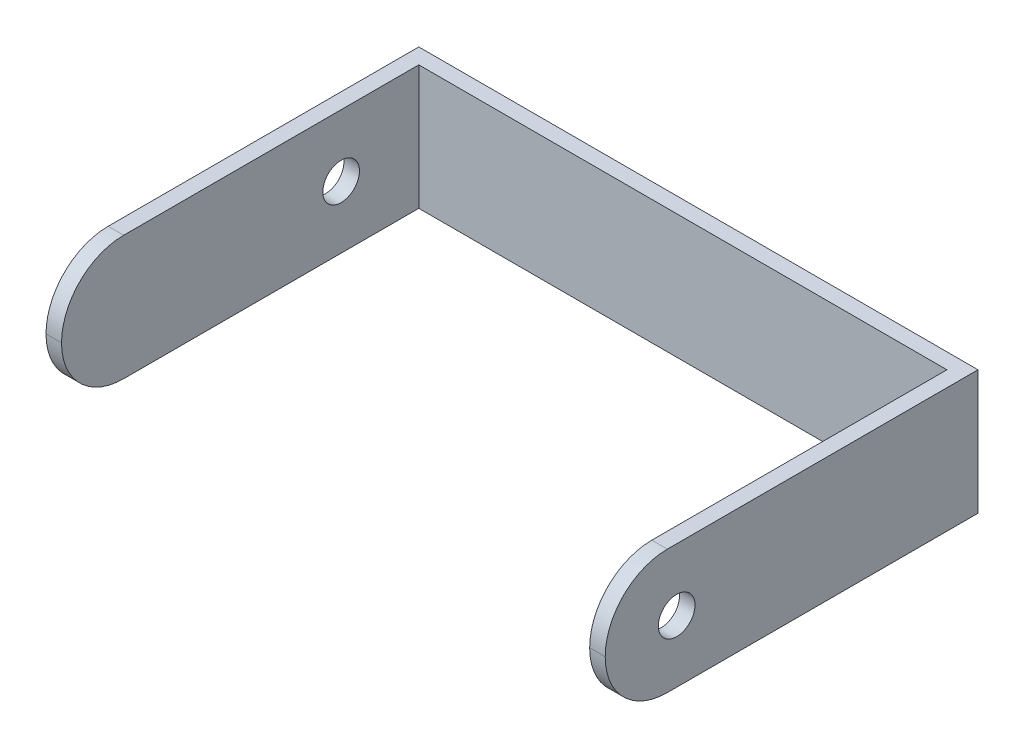
from build123d import *

# Parameters (mm, degrees)
SKETCH1_W           = 457.2
SKETCH1_H           = 101.6
BASE_FLANGE1_DEPTH  = 12.7
SKETCH6_W           = 12.7
SKETCH6_H           = 292.1
BOSS_EXTRUDE1_DEPTH = 101.6
SKETCH9_W           = 12.7
SKETCH9_H           = 292.1
BOSS_EXTRUDE2_DEPTH = 101.6
CUT_EXTRUDE1_REACH  = 560.8
SKETCH12_R          = 14.985
FILLET1_R           = 50.8
FILLET2_R           = 50.8
CUT_EXTRUDE2_REACH  = 560.8
SKETCH13_R          = 14.985


# Sheet-metal steps are written as plain solids
with BuildPart() as part:
    # Sketch1 → Base-Flange1 (new body)
    with BuildSketch(Plane.XY):
        with Locations((228.6, 50.8)):
            Rectangle(SKETCH1_W, SKETCH1_H)
    extrude(amount=BASE_FLANGE1_DEPTH)

    # Sketch6 → Boss-Extrude1 (add, through all)
    with BuildSketch(Plane.XZ):
        with Locations((6.35, 158.75)):
            Rectangle(SKETCH6_W, SKETCH6_H)
    extrude(amount=-BOSS_EXTRUDE1_DEPTH)

    # Sketch9 → Boss-Extrude2 (add, through all)
    with BuildSketch(Plane.XZ):
        with Locations((450.85, 158.75)):
            Rectangle(SKETCH9_W, SKETCH9_H)
    extrude(amount=-BOSS_EXTRUDE2_DEPTH)

    # Sketch12 → Cut-Extrude1 (cut, up to next)
    with BuildSketch(Plane(origin=(457.2, 0, 0), x_dir=(0, 0, -1), z_dir=(1, 0, 0)), mode=Mode.PRIVATE) as cut_extrude1_sk1:
        with Locations((-246.361498901, 50.8)):
            Circle(SKETCH12_R)
    cut_extrude1_tool1 = extrude(cut_extrude1_sk1.sketch, amount=-CUT_EXTRUDE1_REACH, mode=Mode.PRIVATE) & part.part
    add(cut_extrude1_tool1.solids().sort_by_distance((457.2, 50.8, 246.361499))[0], mode=Mode.SUBTRACT)

    # Fillet1
    fillet1_edges = [part.edges().sort_by_distance(p)[0] for p in [
        (450.85, 0, 304.8),
        (450.85, 101.6, 304.8),
    ]]
    fillet(fillet1_edges, radius=FILLET1_R - 0.0001)  # a hair under: the kernel refuses the full size

    # Fillet2
    fillet2_edges = [part.edges().sort_by_distance(p)[0] for p in [
        (6.35, 0, 304.8),
        (6.35, 101.6, 304.8),
    ]]
    fillet(fillet2_edges, radius=FILLET2_R - 0.0001)  # a hair under: the kernel refuses the full size

    # Sketch13 → Cut-Extrude2 (cut, up to next)
    with BuildSketch(Plane.ZY, mode=Mode.PRIVATE) as cut_extrude2_sk1:
        with Locations(Location((76.2, 50.8, 0), (0, 0, 270))):
            Circle(SKETCH13_R)
    cut_extrude2_tool1 = extrude(cut_extrude2_sk1.sketch, amount=-CUT_EXTRUDE2_REACH, mode=Mode.PRIVATE) & part.part
    add(cut_extrude2_tool1.solids().sort_by_distance((0, 50.8, 76.2))[0], mode=Mode.SUBTRACT)


solid = part.part
